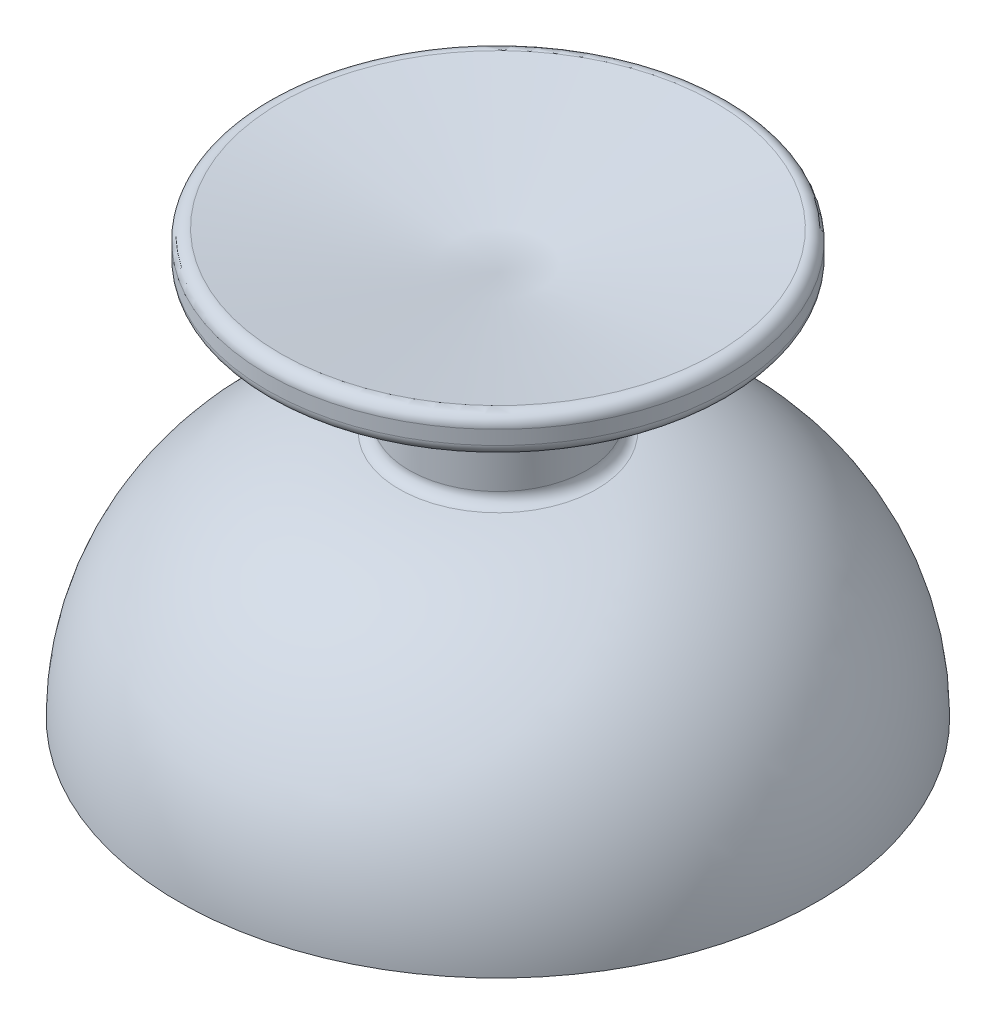
from build123d import *

# Parameters (mm, degrees)
SKETCH3_R           = 2.54
BOSS_EXTRUDE1_DEPTH = 7.1755
FILLET1_R           = 2.54
SKETCH5_R           = 2
CUT_EXTRUDE1_DEPTH  = 9.525
BOSS_EXTRUDE2_DEPTH = 9.525
FILLET2_R           = 0.508
FILLET3_R           = 0.508


with BuildPart() as part:
    # Sketch1 → Revolve1 (revolve)
    with BuildSketch(Plane.XY, mode=Mode.PRIVATE) as revolve1_sk:
        with BuildLine():
            Line((-3.175, 11.1125), (0, 11.1125))
            Line((0, 11.1125), (0, 10.3505))
            Line((0, 10.3505), (-3.175, 10.3505))
            ThreePointArc((-3.175, 10.3505), (-10.493908739, 7.318908739), (-13.5255, 0))
            Line((-13.5255, 0), (-14.2875, 0))
            ThreePointArc((-14.2875, 0), (-11.032724106, 7.857724106), (-3.175, 11.1125))
        make_face()
    revolve(revolve1_sk.sketch.rotate(Axis((0, 0, 0), (0, 1, 0)), 270), axis=Axis((0, 0, 0), (0, 1, 0)))

    # Sketch2 → Revolve2 (revolve)
    with BuildSketch(Plane.XY, mode=Mode.PRIVATE) as revolve2_sk:
        Polygon((0, 11.1125), (-3.96875, 10.973908196), (-3.96875, 13.859825791), (-10.31875, 17.526), (-10.31875, 19.05), (0, 17.230525968), align=None)
    revolve(revolve2_sk.sketch.rotate(Axis((0, 11.1125, 0), (0, 1, 0)), 270), axis=Axis((0, 11.1125, 0), (0, 1, 0)))

    # Sketch3 → Boss-Extrude1 (add)
    with BuildSketch(Plane.XZ.offset(-10.3505)):
        with Locations(Location((0, 0, 0), (0, 0, 90))):
            Circle(SKETCH3_R)
    extrude(amount=BOSS_EXTRUDE1_DEPTH)

    # Fillet1
    fillet1_edges = [part.edges().sort_by_distance(p)[0] for p in [
        (0, 10.3505, -2.54),
    ]]
    fillet(fillet1_edges, radius=FILLET1_R)

    # Sketch5 → Cut-Extrude1 (cut)
    with BuildSketch(Plane.XZ.offset(-3.175)):
        with Locations(Location((0, 0, 0), (0, 0, 270))):
            Circle(SKETCH5_R)
    extrude(amount=-CUT_EXTRUDE1_DEPTH, mode=Mode.SUBTRACT)

    # Sketch6 → Boss-Extrude2 (add)
    with BuildSketch(Plane.XZ.offset(-3.175)):
        with BuildLine():
            Line((-1.5, 1.322875656), (-1.5, -1.322875656))
            ThreePointArc((-1.5, -1.322875656), (-2, 0), (-1.5, 1.322875656))
        make_face()
        with BuildLine():
            Line((1.5, 1.322875656), (1.5, -1.322875656))
            ThreePointArc((1.5, -1.322875656), (2, 0), (1.5, 1.322875656))
        make_face()
    extrude(amount=-BOSS_EXTRUDE2_DEPTH)

    # Fillet2
    fillet2_edges = [part.edges().sort_by_distance(p)[0] for p in [
        (0, 13.859825791, 3.96875),
    ]]
    fillet(fillet2_edges, radius=FILLET2_R)

    # Fillet3
    fillet3_edges = [part.edges().sort_by_distance(p)[0] for p in [
        (0, 17.526, 10.31875),
        (0, 19.05, 10.31875),
    ]]
    fillet(fillet3_edges, radius=FILLET3_R)

    # Fillet5: read off the stored shape, not the designer's step
    # Fillet5 outline → Fillet5 (revolve)
    with BuildSketch(Plane.XY):
        with BuildLine():
            ThreePointArc((4.419842896, 11.042555067), (4.097954007, 11.20886446), (3.96875, 11.547357585))
            Line((3.96875, 11.547357585), (3.96875, 11.042555067))
            Line((3.96875, 11.042555067), (4.419842896, 11.042555067))
        make_face()
    revolve(axis=Axis((0, 0, 0), (0, 1, 0)))


solid = part.part
